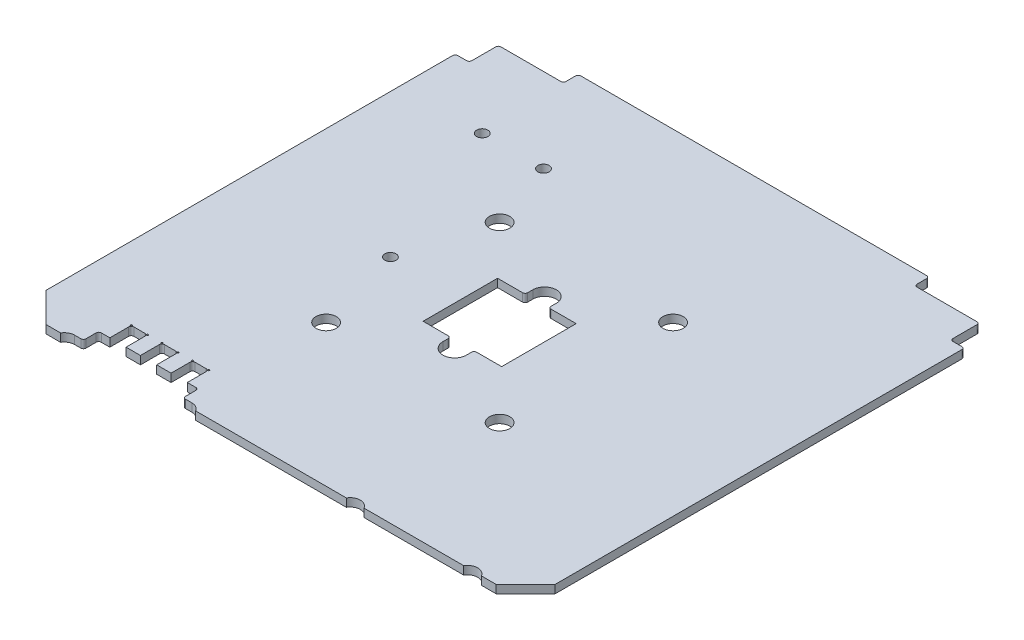
from build123d import *

# Parameters (mm, degrees)
GENERICCARDPCBDEFINITION_FILLET3_START   = -0.8
GENERICCARDPCBDEFINITION_FILLET3_OUTLI_R = 0.16
GENERICCARDPCBDEFINITION_FILLET3_DEPTH   = 1.6
SKETCH1_R                                = 1
SKETCH1_W                                = 15.4
SKETCH1_H                                = 14.6
SKETCH1_W_2                              = 13.4
SKETCH1_H_2                              = 12.6
CUT_EXTRUDE1_DEPTH                       = 10
F_4_0MM_DOWEL_HOLE1_D                    = 4
F_4_0MM_DOWEL_HOLE1_DEPTH                = 29.81
F_4_0MM_DOWEL_HOLE1_TIP                  = 1.201721238
SKETCH5_R                                = 1.1
CUT_EXTRUDE2_DEPTH                       = 71.516735602
FILLET1_R                                = 0.5


# Read off the part's stored shape, not the designer's step: <GenericCardPCBDefinition>-<Fillet3>
with BuildPart() as part:
    # <GenericCardPCBDefinition>-<Fillet3> outli → <GenericCardPCBDefinition>-<Fillet3> (new body)
    with BuildSketch(Plane(origin=(0, 0, 0), x_dir=(1, 0, 0), z_dir=(0, 1, 0)).offset(GENERICCARDPCBDEFINITION_FILLET3_START)):
        with BuildLine():
            ThreePointArc((-41.232050808, -44.8), (-40.5, -44.067949192), (-39.5, -43.8))
            Line((-39.5, -43.8), (-38.267949192, -43.8))
            ThreePointArc((-38.267949192, -43.8), (-37.914395801, -43.653553391), (-37.767949192, -43.3))
            Line((-37.767949192, -43.3), (-37.767949192, -41.3))
            ThreePointArc((-37.767949192, -41.3), (-37.621502583, -40.946446609), (-37.267949192, -40.8))
            Line((-37.267949192, -40.8), (-35.59, -40.8))
            Line((-35.59, -40.8), (-35.59, -37.1))
            ThreePointArc((-35.59, -37.1), (-35.443553391, -36.746446609), (-35.09, -36.6))
            Line((-35.09, -36.6), (-32.91, -36.6))
            ThreePointArc((-32.91, -36.6), (-32.556446609, -36.746446609), (-32.41, -37.1))
            Line((-32.41, -37.1), (-32.41, -40.8))
            Line((-32.41, -40.8), (-29.59, -40.8))
            Line((-29.59, -40.8), (-29.59, -37.1))
            ThreePointArc((-29.59, -37.1), (-29.443553391, -36.746446609), (-29.09, -36.6))
            Line((-29.09, -36.6), (-26.91, -36.6))
            ThreePointArc((-26.91, -36.6), (-26.556446609, -36.746446609), (-26.41, -37.1))
            Line((-26.41, -37.1), (-26.41, -40.8))
            Line((-26.41, -40.8), (-23.59, -40.8))
            Line((-23.59, -40.8), (-23.59, -37.1))
            ThreePointArc((-23.59, -37.1), (-23.443553391, -36.746446609), (-23.09, -36.6))
            Line((-23.09, -36.6), (-20.91, -36.6))
            ThreePointArc((-20.91, -36.6), (-20.556446609, -36.746446609), (-20.41, -37.1))
            Line((-20.41, -37.1), (-20.41, -40.8))
            Line((-20.41, -40.8), (-18.732050808, -40.8))
            ThreePointArc((-18.732050808, -40.8), (-18.378497417, -40.946446609), (-18.232050808, -41.3))
            Line((-18.232050808, -41.3), (-18.232050808, -43.3))
            ThreePointArc((-18.232050808, -43.3), (-18.085604199, -43.653553391), (-17.732050808, -43.8))
            Line((-17.732050808, -43.8), (-16.5, -43.8))
            ThreePointArc((-16.5, -43.8), (-15.5, -44.067949192), (-14.767949192, -44.8))
            Line((-14.767949192, -44.8), (14.767949192, -44.8))
            ThreePointArc((14.767949192, -44.8), (16.5, -43.8), (18.232050808, -44.8))
            Line((18.232050808, -44.8), (37.767949192, -44.8))
            ThreePointArc((37.767949192, -44.8), (39.5, -43.8), (41.232050808, -44.8))
            Line((41.232050808, -44.8), (44.1, -44.8))
            Line((44.1, -44.8), (49.9, -39))
            Line((49.9, -39), (49.9, 40.7))
            ThreePointArc((49.9, 40.7), (49.753553391, 41.053553391), (49.4, 41.2))
            Line((49.4, 41.2), (47.65, 41.2))
            ThreePointArc((47.65, 41.2), (47.296446609, 41.346446609), (47.15, 41.7))
            Line((47.15, 41.7), (47.15, 46.4))
            ThreePointArc((47.15, 46.4), (47.003553391, 46.753553391), (46.65, 46.9))
            Line((46.65, 46.9), (34.9, 46.9))
            ThreePointArc((34.9, 46.9), (34.546446609, 47.046446609), (34.4, 47.4))
            Line((34.4, 47.4), (34.4, 49.3))
            ThreePointArc((34.4, 49.3), (34.253553391, 49.653553391), (33.9, 49.8))
            Line((33.9, 49.8), (-33.9, 49.8))
            ThreePointArc((-33.9, 49.8), (-34.253553391, 49.653553391), (-34.4, 49.3))
            Line((-34.4, 49.3), (-34.4, 47.4))
            ThreePointArc((-34.4, 47.4), (-34.546446609, 47.046446609), (-34.9, 46.9))
            Line((-34.9, 46.9), (-46.65, 46.9))
            ThreePointArc((-46.65, 46.9), (-47.003553391, 46.753553391), (-47.15, 46.4))
            Line((-47.15, 46.4), (-47.15, 41.7))
            ThreePointArc((-47.15, 41.7), (-47.296446609, 41.346446609), (-47.65, 41.2))
            Line((-47.65, 41.2), (-49.4, 41.2))
            ThreePointArc((-49.4, 41.2), (-49.753553391, 41.053553391), (-49.9, 40.7))
            Line((-49.9, 40.7), (-49.9, -39))
            Line((-49.9, -39), (-44.1, -44.8))
            Line((-44.1, -44.8), (-41.232050808, -44.8))
        make_face()
        with Locations((-35.59, -36.6)):
            Circle(GENERICCARDPCBDEFINITION_FILLET3_OUTLI_R, mode=Mode.SUBTRACT)
        with Locations((-32.41, -36.6)):
            Circle(GENERICCARDPCBDEFINITION_FILLET3_OUTLI_R, mode=Mode.SUBTRACT)
        with Locations((-29.59, -36.6)):
            Circle(GENERICCARDPCBDEFINITION_FILLET3_OUTLI_R, mode=Mode.SUBTRACT)
        with Locations((-26.41, -36.6)):
            Circle(GENERICCARDPCBDEFINITION_FILLET3_OUTLI_R, mode=Mode.SUBTRACT)
        with Locations((-23.59, -36.6)):
            Circle(GENERICCARDPCBDEFINITION_FILLET3_OUTLI_R, mode=Mode.SUBTRACT)
        with Locations((-20.41, -36.6)):
            Circle(GENERICCARDPCBDEFINITION_FILLET3_OUTLI_R, mode=Mode.SUBTRACT)
    extrude(amount=GENERICCARDPCBDEFINITION_FILLET3_DEPTH)

    # Sketch1 → Cut-Extrude1 (cut)
    # profile 1 of 6: a face of its own
    with BuildSketch(Plane(origin=(0, 0.8, 0), x_dir=(1, 0, 0), z_dir=(0, 1, 0))):
        with BuildLine():
            Line((2.3, -7.3), (-2.3, -7.3))
            Line((-2.3, -7.3), (-2.3, -8.8))
            ThreePointArc((-2.3, -8.8), (0, -11.1), (2.3, -8.8))
            Line((2.3, -8.8), (2.3, -7.3))
        make_face()
        with Locations((0, -9)):
            Circle(SKETCH1_R, mode=Mode.SUBTRACT)
    # profile 2 of 6: a face of its own
    with BuildSketch(Plane(origin=(0, 0.8, 0), x_dir=(1, 0, 0), z_dir=(0, 1, 0))):
        Rectangle(SKETCH1_W, SKETCH1_H)
        Rectangle(SKETCH1_W_2, SKETCH1_H_2, mode=Mode.SUBTRACT)
    # profile 3 of 6: a face of its own
    with BuildSketch(Plane(origin=(0, 0.8, 0), x_dir=(1, 0, 0), z_dir=(0, 1, 0))):
        Rectangle(SKETCH1_W_2, SKETCH1_H_2)
    # profile 4 of 6: a face of its own
    with BuildSketch(Plane(origin=(0, 0.8, 0), x_dir=(1, 0, 0), z_dir=(0, 1, 0))):
        with BuildLine():
            Line((-2.3, 8.8), (-2.3, 7.3))
            Line((-2.3, 7.3), (2.3, 7.3))
            Line((2.3, 7.3), (2.3, 8.8))
            ThreePointArc((2.3, 8.8), (0, 11.1), (-2.3, 8.8))
        make_face()
        with Locations((0, 9)):
            Circle(SKETCH1_R, mode=Mode.SUBTRACT)
    # profile 5 of 6: a face of its own
    with BuildSketch(Plane(origin=(0, 0.8, 0), x_dir=(1, 0, 0), z_dir=(0, 1, 0))):
        with Locations((0, 9)):
            Circle(SKETCH1_R)
    # profile 6 of 6: a face of its own
    with BuildSketch(Plane(origin=(0, 0.8, 0), x_dir=(1, 0, 0), z_dir=(0, 1, 0))):
        with Locations((0, -9)):
            Circle(SKETCH1_R)
    extrude(amount=-CUT_EXTRUDE1_DEPTH, mode=Mode.SUBTRACT)

    # Ø4.0mm Dowel Hole1
    with Locations(Plane(origin=(0, -0.8, 0), x_dir=(-1, 0, 0), z_dir=(0, -1, 0))):
        with Locations((17, -17), (-17, -17), (17, 17), (-17, 17)):
            Hole(F_4_0MM_DOWEL_HOLE1_D / 2, depth=F_4_0MM_DOWEL_HOLE1_DEPTH)
            with Locations((0, 0, -(F_4_0MM_DOWEL_HOLE1_DEPTH + F_4_0MM_DOWEL_HOLE1_TIP / 2))):  # 118° drill point
                Cone(0, F_4_0MM_DOWEL_HOLE1_D / 2, F_4_0MM_DOWEL_HOLE1_TIP, mode=Mode.SUBTRACT)

    # Sketch5 → Cut-Extrude2 (cut, through all)
    with BuildSketch(Plane.XZ.offset(0.8)):
        with Locations(Location((-33.8, -30.4, 0), (0, 0, 270))):
            Circle(SKETCH5_R)
        with Locations(Location((-21.8, -30.4, 0), (0, 0, 270))):
            Circle(SKETCH5_R)
        with Locations(Location((-21.8, -0.4, 0), (0, 0, 270))):
            Circle(SKETCH5_R)
    extrude(amount=-CUT_EXTRUDE2_DEPTH, mode=Mode.SUBTRACT)

    # Fillet1
    fillet1_edges = [part.edges().sort_by_distance(p)[0] for p in [
        (-2.3, 0, 7.3),
        (-2.3, 0, -7.3),
        (2.3, 0, -7.3),
        (2.3, 0, 7.3),
    ]]
    fillet(fillet1_edges, radius=FILLET1_R)


solid = part.part
